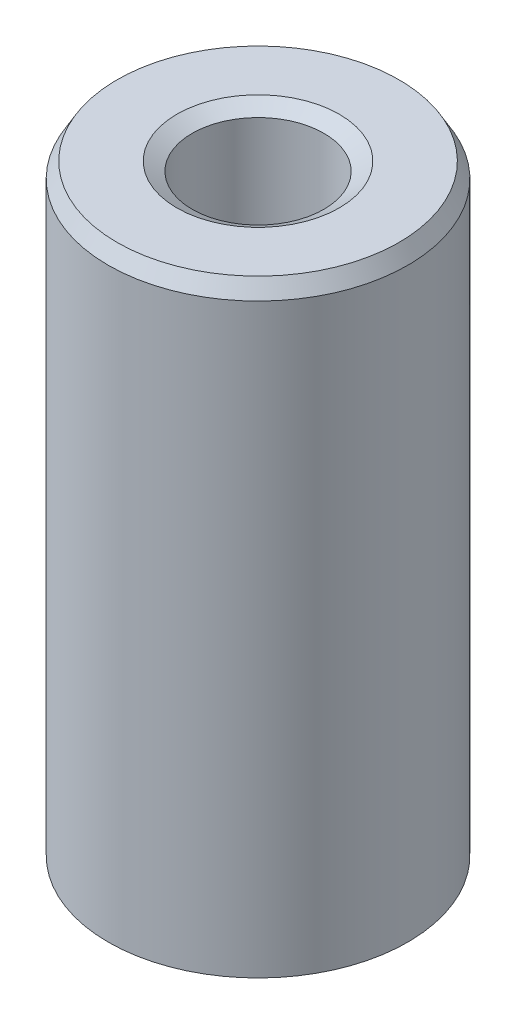
from build123d import *
from OCP.BRepFilletAPI import BRepFilletAPI_MakeChamfer

# Parameters (mm, degrees)
SKETCH1_R           = 17.5
BOSS_EXTRUDE1_DEPTH = 71.307436726
SKETCH2_R           = 7.69563621
CUT_EXTRUDE1_DEPTH  = 76.480133363
CHAMFER1_SIZE       = 1.791079597
CHAMFER1_SIZE2      = 1.034080288


with BuildPart() as part:
    # Sketch1 → Boss-Extrude1 (new body)
    with BuildSketch(Plane(origin=(0, 0, 0), x_dir=(1, 0, 0), z_dir=(0, 1, 0))):
        Circle(SKETCH1_R)
    extrude(amount=BOSS_EXTRUDE1_DEPTH)

    # Sketch2 → Cut-Extrude1 (cut, through all)
    with BuildSketch(Plane(origin=(0, 0, 0), x_dir=(1, 0, 0), z_dir=(0, 1, 0))):
        Circle(SKETCH2_R)
    extrude(amount=CUT_EXTRUDE1_DEPTH, mode=Mode.SUBTRACT)

    # Chamfer1: one chamfer whose edges measure the first distance from different faces: ONE call of the kernel's chamfer builder (chamfer() names one face for all edges)
    chamfer1_edges_1 = [part.edges().sort_by_distance(p)[0] for p in [
        (-7.69563621, 71.307436726, 0),
    ]]
    chamfer1_side_1 = [part.faces().sort_by_distance(p)[0] for p in [
        (-17.005025253, 71.307436726, 0),
    ]]
    chamfer1_edges_2 = [part.edges().sort_by_distance(p)[0] for p in [
        (-7.69563621, 0, 0),
    ]]
    chamfer1_side_2 = [part.faces().sort_by_distance(p)[0] for p in [
        (-7.69563621, 35.653718363, 0),
    ]]
    chamfer1_edges_3 = [part.edges().sort_by_distance(p)[0] for p in [
        (-17.5, 0, 0),
    ]]
    chamfer1_side_3 = [part.faces().sort_by_distance(p)[0] for p in [
        (-17.005025253, 0, 0),
    ]]
    chamfer1_edges_4 = [part.edges().sort_by_distance(p)[0] for p in [
        (-17.5, 71.307436726, 0),
    ]]
    chamfer1_side_4 = [part.faces().sort_by_distance(p)[0] for p in [
        (-17.5, 35.653718363, 0),
    ]]
    chamfer1 = BRepFilletAPI_MakeChamfer(part.part.solid().wrapped)
    for e in chamfer1_edges_1:
        chamfer1.Add(CHAMFER1_SIZE, CHAMFER1_SIZE2, e.wrapped, chamfer1_side_1[0].wrapped)  # the first distance lies on this face
    for e in chamfer1_edges_2:
        chamfer1.Add(CHAMFER1_SIZE, CHAMFER1_SIZE2, e.wrapped, chamfer1_side_2[0].wrapped)  # the first distance lies on this face
    for e in chamfer1_edges_3:
        chamfer1.Add(CHAMFER1_SIZE, CHAMFER1_SIZE2, e.wrapped, chamfer1_side_3[0].wrapped)  # the first distance lies on this face
    for e in chamfer1_edges_4:
        chamfer1.Add(CHAMFER1_SIZE, CHAMFER1_SIZE2, e.wrapped, chamfer1_side_4[0].wrapped)  # the first distance lies on this face
    add(Compound.cast(chamfer1.Shape()), mode=Mode.REPLACE)


solid = part.part
